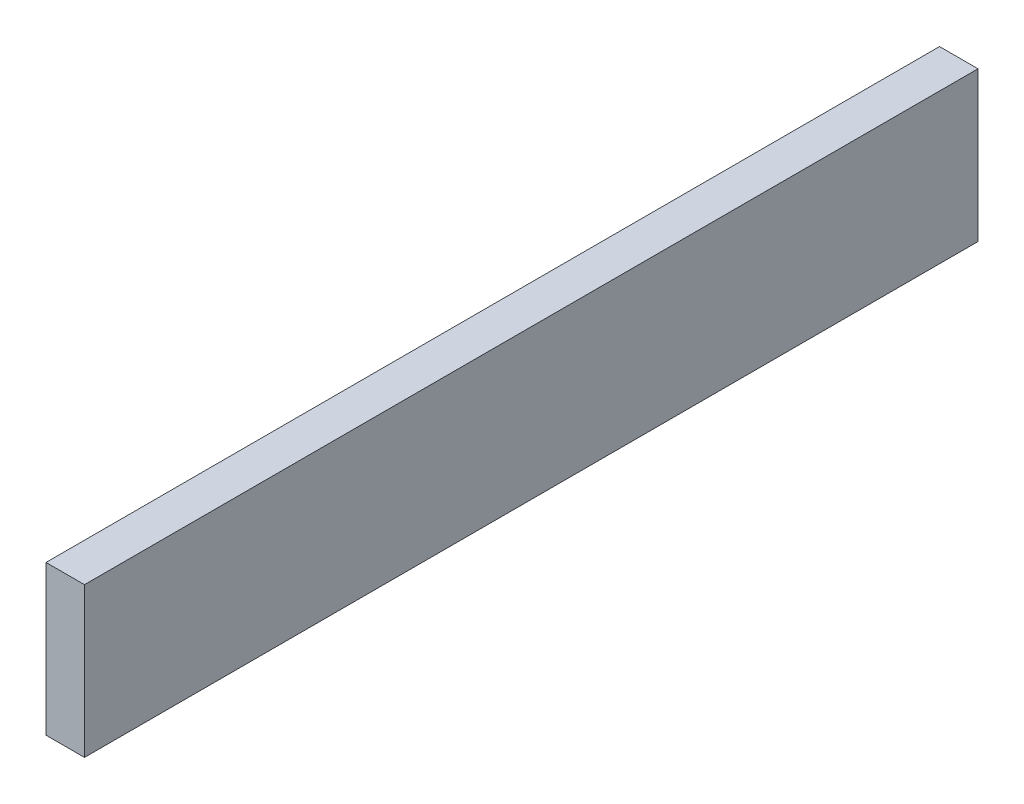
from build123d import *

# Parameters (mm, degrees)
SKETCH1_W           = 418
SKETCH1_H           = 70
BOSS_EXTRUDE1_DEPTH = 18


with BuildPart() as part:
    # Sketch1 → Boss-Extrude1 (new body)
    with BuildSketch(Plane(origin=(0, 0, 0), x_dir=(0, 0, -1), z_dir=(1, 0, 0))):
        with Locations((209, 35)):
            Rectangle(SKETCH1_W, SKETCH1_H)
    extrude(amount=BOSS_EXTRUDE1_DEPTH)


solid = part.part
